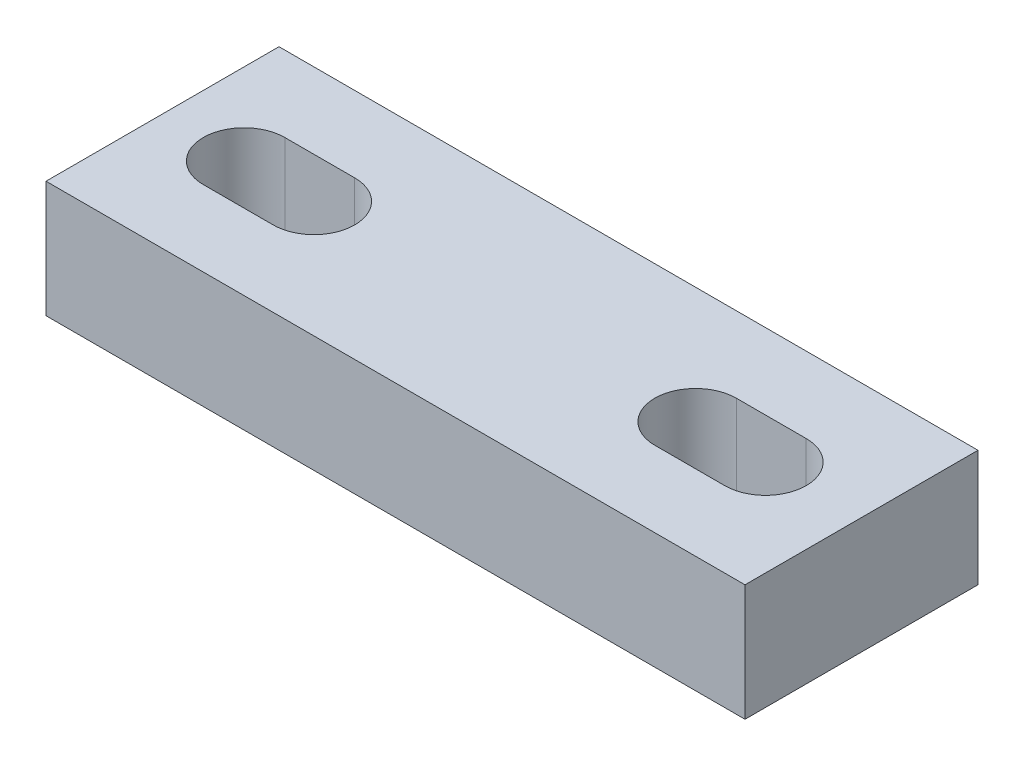
from build123d import *

# Parameters (mm, degrees)
SCHIZZO1_W                   = 30
SCHIZZO1_H                   = 5
ESTRUSIONE_ESTRUSIONE1_DEPTH = 10
TAGLIO_ESTRUSIONE1_DEPTH     = 10


with BuildPart() as part:
    # Schizzo1 → Estrusione-Estrusione1 (new body)
    with BuildSketch(Plane.XY):
        with Locations((0, 2.5)):
            Rectangle(SCHIZZO1_W, SCHIZZO1_H)
    extrude(amount=ESTRUSIONE_ESTRUSIONE1_DEPTH)

    # Schizzo2 → Taglio-Estrusione1 (cut)
    with BuildSketch(Plane(origin=(0, 5, 0), x_dir=(1, 0, 0), z_dir=(0, 1, 0))):
        with BuildLine():
            Line((-11.5, -3.25), (-8.5, -3.25))
            ThreePointArc((-8.5, -3.25), (-6.75, -5), (-8.5, -6.75))
            Line((-8.5, -6.75), (-11.5, -6.75))
            ThreePointArc((-11.5, -6.75), (-13.25, -5), (-11.5, -3.25))
        make_face()
        with BuildLine():
            Line((10.878572322, -3.25), (7.878572322, -3.25))
            ThreePointArc((7.878572322, -3.25), (6.128572322, -5), (7.878572322, -6.75))
            Line((7.878572322, -6.75), (10.878572322, -6.75))
            ThreePointArc((10.878572322, -6.75), (12.628572322, -5), (10.878572322, -3.25))
        make_face()
    extrude(amount=-TAGLIO_ESTRUSIONE1_DEPTH, mode=Mode.SUBTRACT)


solid = part.part
